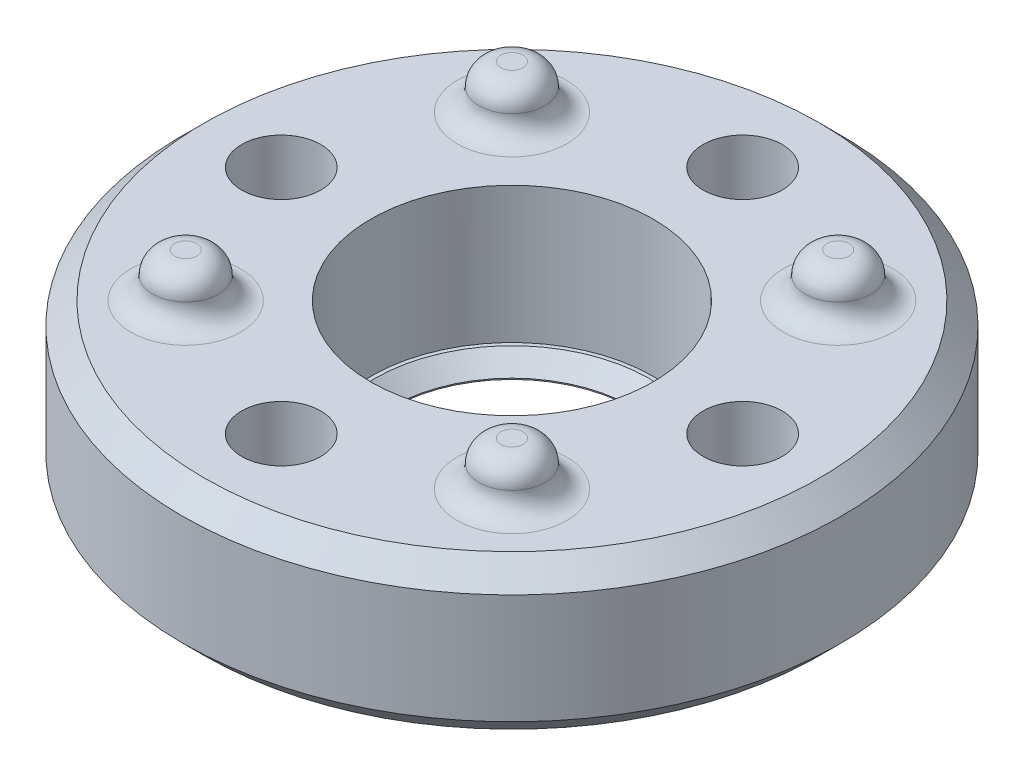
from build123d import *

# Parameters (mm, degrees)
SKETCH1_R           = 15
SKETCH1_R_2         = 6.425
BOSS_EXTRUDE1_DEPTH = 7
SKETCH2_R           = 1.8
CUT_EXTRUDE1_DEPTH  = 23.338307904
SKETCH3_R           = 3.25
CUT_EXTRUDE2_DEPTH  = 2
FILLET1_R           = 1.5
CHAMFER1_SIZE       = 1
CHAMFER2_SIZE       = 1
SKETCH4_R           = 1.5
BOSS_EXTRUDE2_DEPTH = 2
FILLET2_R           = 1
SKETCH5_R           = 6.679859281
SKETCH5_R_2         = 5.5
BOSS_EXTRUDE3_DEPTH = 0.8
CHAMFER3_SIZE       = 0.75


# Some blends are built 0.0001 mm under size
with BuildPart() as part:
    # Sketch1 → Boss-Extrude1 (new body)
    with BuildSketch(Plane(origin=(0, 0, 0), x_dir=(1, 0, 0), z_dir=(0, 1, 0))):
        with Locations(Location((0, 0, 0), (0, 0, 270))):
            Circle(SKETCH1_R)
        with Locations(Location((0, 0, 0), (0, 0, 270))):
            Circle(SKETCH1_R_2, mode=Mode.SUBTRACT)
    extrude(amount=BOSS_EXTRUDE1_DEPTH)

    # Sketch2 → Cut-Extrude1 (cut, through all)
    with BuildSketch(Plane.XZ):
        with Locations(Location((0, 10.5, 0), (0, 0, 270))):
            Circle(SKETCH2_R)
        with Locations(Location((10.5, 0, 0), (0, 0, 270))):
            Circle(SKETCH2_R)
        with Locations(Location((0, -10.5, 0), (0, 0, 270))):
            Circle(SKETCH2_R)
        with Locations(Location((-10.5, 0, 0), (0, 0, 270))):
            Circle(SKETCH2_R)
    extrude(amount=-CUT_EXTRUDE1_DEPTH, mode=Mode.SUBTRACT)

    # Sketch3 → Cut-Extrude2 (cut)
    with BuildSketch(Plane.XZ):
        with Locations(Location((0, 10.5, 0), (0, 0, 270))):
            Circle(SKETCH3_R)
        with Locations(Location((10.5, 0, 0), (0, 0, 270))):
            Circle(SKETCH3_R)
        with Locations(Location((0, -10.5, 0), (0, 0, 270))):
            Circle(SKETCH3_R)
        with Locations(Location((-10.5, 0, 0), (0, 0, 270))):
            Circle(SKETCH3_R)
    extrude(amount=-CUT_EXTRUDE2_DEPTH, mode=Mode.SUBTRACT)

    # Fillet1
    # the kernel refuses this fillet: 1.5 mm, written as the material it adds along each edge
    with BuildSketch(Plane(origin=(0, 2, 10.5), x_dir=(0, 0, -1), z_dir=(-1, 0, 0))) as fillet1_piece_1_section:
        with BuildLine():
            CenterArc((3.25 - FILLET1_R, FILLET1_R), FILLET1_R, 270, 90)
            Line((3.25 - FILLET1_R, 0), (3.25, 0))
            Line((3.25, 0), (3.25, FILLET1_R))
        make_face()
    fillet1_piece_1 = revolve(axis=Axis((0, 2, 10.5), (0, -1, 0)), mode=Mode.PRIVATE)
    fillet1_piece_1 = fillet1_piece_1 - Plane(origin=(0, 1.558044344, 10.5), x_dir=(0, 0, -1), z_dir=(0, -1, 0)) * Cylinder(1.8, 13, mode=Mode.PRIVATE)
    add(fillet1_piece_1)
    with BuildSketch(Plane(origin=(10.5, 2, 0), x_dir=(0, 0, -1), z_dir=(-1, 0, 0))) as fillet1_piece_2_section:
        with BuildLine():
            CenterArc((3.25 - FILLET1_R, FILLET1_R), FILLET1_R, 270, 90)
            Line((3.25 - FILLET1_R, 0), (3.25, 0))
            Line((3.25, 0), (3.25, FILLET1_R))
        make_face()
    fillet1_piece_2 = revolve(axis=Axis((10.5, 2, 0), (0, -1, 0)), mode=Mode.PRIVATE)
    fillet1_piece_2 = fillet1_piece_2 - Plane(origin=(10.5, 1.558044344, 0), x_dir=(0, 0, -1), z_dir=(0, -1, 0)) * Cylinder(1.8, 14, mode=Mode.PRIVATE)
    add(fillet1_piece_2)
    with BuildSketch(Plane(origin=(0, 2, -10.5), x_dir=(0, 0, -1), z_dir=(-1, 0, 0))) as fillet1_piece_3_section:
        with BuildLine():
            CenterArc((3.25 - FILLET1_R, FILLET1_R), FILLET1_R, 270, 90)
            Line((3.25 - FILLET1_R, 0), (3.25, 0))
            Line((3.25, 0), (3.25, FILLET1_R))
        make_face()
    fillet1_piece_3 = revolve(axis=Axis((0, 2, -10.5), (0, -1, 0)), mode=Mode.PRIVATE)
    fillet1_piece_3 = fillet1_piece_3 - Plane(origin=(0, 1.558044344, -10.5), x_dir=(0, 0, -1), z_dir=(0, -1, 0)) * Cylinder(1.8, 14, mode=Mode.PRIVATE)
    add(fillet1_piece_3)
    with BuildSketch(Plane(origin=(-10.5, 2, 0), x_dir=(0, 0, -1), z_dir=(-1, 0, 0))) as fillet1_piece_4_section:
        with BuildLine():
            CenterArc((3.25 - FILLET1_R, FILLET1_R), FILLET1_R, 270, 90)
            Line((3.25 - FILLET1_R, 0), (3.25, 0))
            Line((3.25, 0), (3.25, FILLET1_R))
        make_face()
    fillet1_piece_4 = revolve(axis=Axis((-10.5, 2, 0), (0, -1, 0)), mode=Mode.PRIVATE)
    fillet1_piece_4 = fillet1_piece_4 - Plane(origin=(-10.5, 1.558044344, 0), x_dir=(0, 0, -1), z_dir=(0, -1, 0)) * Cylinder(1.8, 13, mode=Mode.PRIVATE)
    add(fillet1_piece_4)

    # Chamfer1
    chamfer1_edges = [part.edges().sort_by_distance(p)[0] for p in [
        (0, 7, -15),
    ]]
    chamfer(chamfer1_edges, length=CHAMFER1_SIZE)

    # Chamfer2
    chamfer2_edges = [part.edges().sort_by_distance(p)[0] for p in [
        (0, 0, -15),
    ]]
    chamfer(chamfer2_edges, length=CHAMFER2_SIZE)

    # Sketch4 → Boss-Extrude2 (add)
    with BuildSketch(Plane(origin=(0, 7, 0), x_dir=(1, 0, 0), z_dir=(0, 1, 0))):
        with Locations(Location((7.424621202, 7.424621202, 0), (0, 0, 270))):
            Circle(SKETCH4_R)
        with Locations(Location((7.424621202, -7.424621202, 0), (0, 0, 270))):
            Circle(SKETCH4_R)
        with Locations(Location((-7.424621202, -7.424621202, 0), (0, 0, 270))):
            Circle(SKETCH4_R)
        with Locations(Location((-7.424621202, 7.424621202, 0), (0, 0, 270))):
            Circle(SKETCH4_R)
    extrude(amount=BOSS_EXTRUDE2_DEPTH)

    # Fillet2
    fillet2_edges = [part.edges().sort_by_distance(p)[0] for p in [
        (7.424621202, 7, -8.924621202),
        (7.424621202, 9, -8.924621202),
        (7.424621202, 7, 5.924621202),
        (7.424621202, 9, 5.924621202),
        (-7.424621202, 7, 5.924621202),
        (-7.424621202, 9, 5.924621202),
        (-7.424621202, 7, -8.924621202),
        (-7.424621202, 9, -8.924621202),
    ]]
    fillet(fillet2_edges, radius=FILLET2_R - 0.0001)  # a hair under: the kernel refuses the full size

    # Sketch5 → Boss-Extrude3 (add)
    with BuildSketch(Plane.XZ):
        Circle(SKETCH5_R)
        with Locations(Location((0, 0, 0), (0, 0, 270))):
            Circle(SKETCH5_R_2, mode=Mode.SUBTRACT)
    extrude(amount=-BOSS_EXTRUDE3_DEPTH)

    # Chamfer3
    chamfer3_edges = [part.edges().sort_by_distance(p)[0] for p in [
        (0, 0.8, 5.5),
    ]]
    chamfer(chamfer3_edges, length=CHAMFER3_SIZE)


solid = part.part
